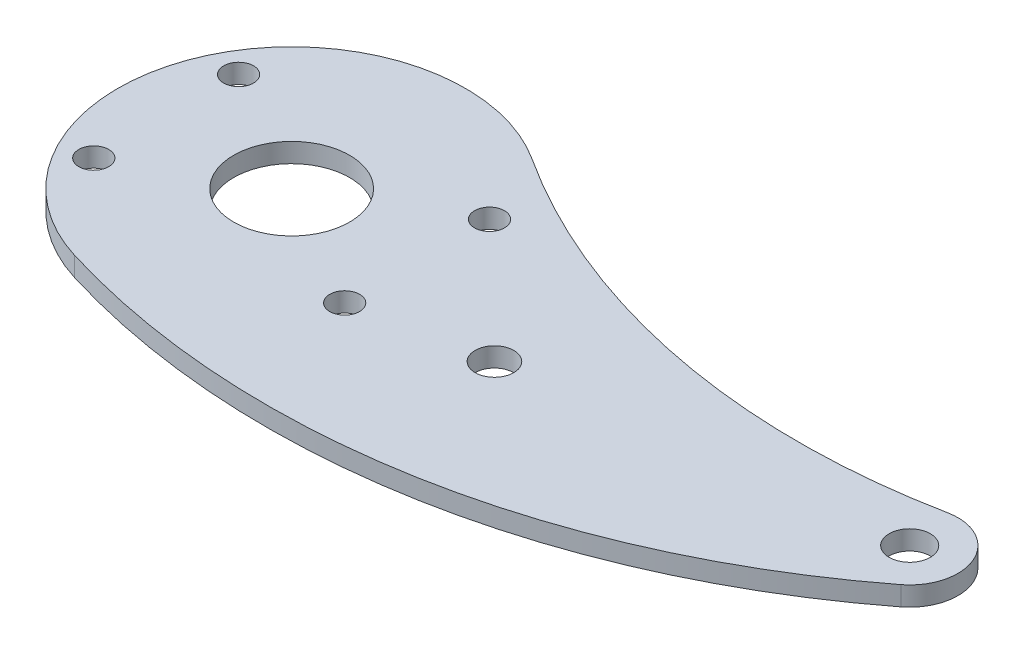
from build123d import *

# Parameters (mm, degrees)
SKETCH1_R                    = 9.525
SKETCH1_R_2                  = 3.3782
BOSS_EXTRUDE1_DEPTH          = 3.175
F_10_0_1935_DIAMETER_HOLE1_D = 4.9149
F_1_4_0_25_DIAMETER_HOLE2_D  = 6.35


with BuildPart() as part:
    # Sketch1 → Boss-Extrude1 (new body)
    with BuildSketch(Plane(origin=(0, 0, 0), x_dir=(1, 0, 0), z_dir=(0, 1, 0))):
        with BuildLine():
            ThreePointArc((100.049707031, 7.784632166), (56.215627572, 7.625525419), (15.545097656, 23.976667072))
            ThreePointArc((15.545097656, 23.976667072), (-25.906449023, 12.057633434), (-8.335575227, -27.332193667))
            ThreePointArc((-8.335575227, -27.332193667), (51.623799583, -30.771841696), (106.459238281, -6.276281509))
            ThreePointArc((106.459238281, -6.276281509), (108.822506706, 3.292309696), (100.049707031, 7.784632166))
        make_face()
        Circle(SKETCH1_R, mode=Mode.SUBTRACT)
        with Locations((101.6, 0)):
            Circle(SKETCH1_R_2, mode=Mode.SUBTRACT)
    extrude(amount=BOSS_EXTRUDE1_DEPTH)

    # #10 (0.1935) Diameter Hole1 (through all)
    with Locations(Plane(origin=(0, 3.175, 0), x_dir=(1, 0, 0), z_dir=(0, 1, 0))):
        with Locations((-20.622229928, -11.90625), (-20.622229928, 11.90625), (20.622229928, 11.90625), (20.622229928, -11.90625)):
            Hole(F_10_0_1935_DIAMETER_HOLE1_D / 2)

    # 1/4 (0.25) Diameter Hole2 (through all)
    with Locations(Plane(origin=(0, 3.175, 0), x_dir=(1, 0, 0), z_dir=(0, 1, 0))):
        with Locations((41.275, -7.9375)):
            Hole(F_1_4_0_25_DIAMETER_HOLE2_D / 2)


solid = part.part
